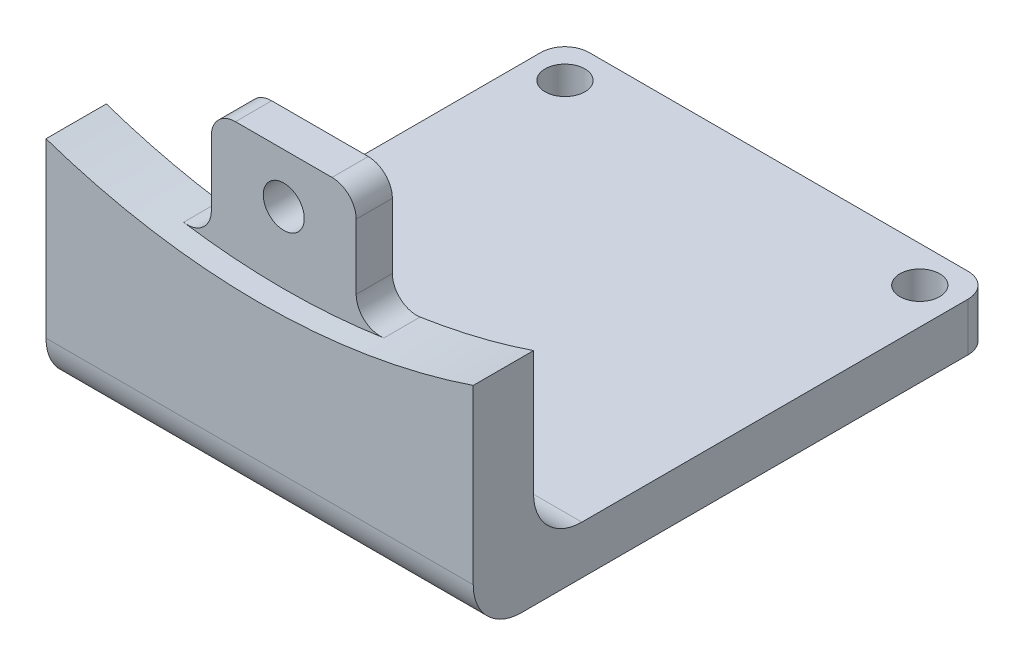
from build123d import *

# Parameters (mm, degrees)
SKETCH_1_W          = 35.4
SKETCH_1_H          = 43
SKETCH_1_R          = 1.65
EXTRUDE_1_DEPTH     = 4
SKETCH_2_W          = 35.4
SKETCH_2_H          = 5
EXTRUDE_2_DEPTH     = 20
SKETCH_3_R          = 55
CUT_EXTRUDE_1_DEPTH = 52.689555338
EXTRUDE_3_DEPTH     = 3
SKETCH_5_R          = 1.7
CUT_EXTRUDE_2_DEPTH = 53.34683038
FILLET_2_R          = 2
CUT_EXTRUDE_START   = -3
CUT_EXTRUDE_3_DEPTH = 3
FILLET_3_R          = 4
FILLET_4_R          = 4


# Read off the part's stored shape, not the designer's step: 切除-拉伸3
with BuildPart() as part:
    # 草图1 → 凸台-拉伸1 (new body)
    with BuildSketch(Plane(origin=(0, 0, 0), x_dir=(1, 0, 0), z_dir=(0, 1, 0))):
        with Locations((7.830572478, 3.085726019)):
            Rectangle(SKETCH_1_W, SKETCH_1_H)
        with Locations(Location((-6.869427522, 21.585726019, 0), (0, 0, 270))):
            Circle(SKETCH_1_R, mode=Mode.SUBTRACT)
        with Locations(Location((22.530572478, 21.585726019, 0), (0, 0, 270))):
            Circle(SKETCH_1_R, mode=Mode.SUBTRACT)
    extrude(amount=EXTRUDE_1_DEPTH)

    # 草图2 → 凸台-拉伸2 (add)
    with BuildSketch(Plane(origin=(0, 4, 0), x_dir=(1, 0, 0), z_dir=(0, 1, 0))):
        with Locations((7.830572478, -15.914273981)):
            Rectangle(SKETCH_2_W, SKETCH_2_H)
    extrude(amount=EXTRUDE_2_DEPTH)

    # 草图3 → 切除-拉伸1 (cut, through all)
    with BuildSketch(Plane(origin=(0, 0, 13.414273981), x_dir=(-1, 0, 0), z_dir=(0, 0, -1))):
        with Locations((-7.830572478, 70.384651263)):
            Circle(SKETCH_3_R)
    extrude(amount=-CUT_EXTRUDE_1_DEPTH, mode=Mode.SUBTRACT)

    # 草图4 → 凸台-拉伸3 (add)
    with BuildSketch(Plane(origin=(0, 0, 13.414273981), x_dir=(-1, 0, 0), z_dir=(0, 0, -1))):
        Polygon((-7.830572478, 25.384651263), (-13.830572478, 25.384651263), (-13.830572478, 12.582595885), (-1.830572478, 12.582595885), (-1.830572478, 25.384651263), align=None)
    extrude(amount=-EXTRUDE_3_DEPTH)

    # 草图5 → 切除-拉伸2 (cut, through all)
    with BuildSketch(Plane(origin=(0, 0, 13.414273981), x_dir=(-1, 0, 0), z_dir=(0, 0, -1))):
        with Locations((-7.830572478, 21.284651263)):
            Circle(SKETCH_5_R)
    extrude(amount=-CUT_EXTRUDE_2_DEPTH, mode=Mode.SUBTRACT)

    # 圆角2
    fillet_2_edges = [part.edges().sort_by_distance(p)[0] for p in [
        (13.830572478, 15.712903531, 14.914273981),
        (1.830572478, 15.712903531, 14.914273981),
        (1.830572478, 25.384651263, 14.914273981),
        (13.830572478, 25.384651263, 14.914273981),
        (-9.869427522, 2, -24.585726019),
        (25.530572478, 2, -24.585726019),
    ]]
    fillet(fillet_2_edges, radius=FILLET_2_R)

    # 切除-拉伸3 outline → 切除-拉伸3 (cut)
    # profile 1 of 3: a face of its own
    with BuildSketch(Plane.ZY.offset(9.869427522).offset(CUT_EXTRUDE_START)):
        with BuildLine():
            add(Edge.make_bspline(
                [(8.542988895, 3.699263411), (8.578017603, 3.693525875), (8.648085356, 3.682049107), (8.749158834, 3.64727766), (8.844028059, 3.59764261), (8.913104505, 3.542504105), (8.953125929, 3.504314465), (8.966771114, 3.490143141), (8.968705452, 3.488113466)],
                knots=[0, 0, 0, 0, 0.181146539, 0.362346535, 0.543653396, 0.725617877, 0.811880467, 0.826217423, 0.826217423, 0.826217423, 0.826217423], degree=3))
            add(Edge.make_bspline(
                [(7.796451499, 2.585796546), (7.806473258, 2.660623766), (7.82639357, 2.809358292), (7.871818557, 2.989926881), (7.915645712, 3.125628587), (7.948457101, 3.217263331), (7.984732325, 3.297067627), (8.020915746, 3.367793665), (8.061564878, 3.429260285), (8.104415721, 3.484405595), (8.150999897, 3.53355184), (8.20072521, 3.575324459), (8.249879153, 3.610852801), (8.295037608, 3.641147726), (8.336271324, 3.663779176), (8.386620864, 3.685745692), (8.455521175, 3.701982318), (8.51231786, 3.700216811), (8.542988895, 3.699263411)],
                knots=[0, 0, 0, 0, 0.154226345, 0.306556652, 0.379675384, 0.445752334, 0.50534458, 0.558760679, 0.607948867, 0.655725679, 0.701371485, 0.746071266, 0.78825069, 0.825317709, 0.857153149, 0.884242778, 0.937489417, 1, 1, 1, 1], degree=3))
            add(Edge.make_bspline(
                [(8.610855931, 0.408085061), (8.575714957, 0.406913862), (8.504992138, 0.404556772), (8.400847519, 0.426830292), (8.304198088, 0.464755289), (8.229785389, 0.507010784), (8.177926324, 0.550761223), (8.139300445, 0.588028867), (8.103317507, 0.632319006), (8.067803178, 0.682054067), (8.033986779, 0.737795062), (8.000738638, 0.799355074), (7.969947041, 0.867439943), (7.927955442, 0.967649618), (7.883311778, 1.105978134), (7.848061477, 1.253243487), (7.824628691, 1.379539283), (7.810100145, 1.481640827), (7.796562361, 1.588515188), (7.781651532, 1.737314883), (7.770871829, 1.923867335), (7.764484201, 2.146011881), (7.771015856, 2.366377706), (7.787931468, 2.512299076), (7.796451499, 2.585796546)],
                knots=[0, 0, 0, 0, 0.040560554, 0.081629972, 0.122067936, 0.160498857, 0.179908728, 0.200453509, 0.222515076, 0.245822335, 0.271131183, 0.297900222, 0.326730499, 0.357554046, 0.423594813, 0.494619703, 0.532646947, 0.572188961, 0.613933823, 0.657297468, 0.745202701, 0.830085187, 0.914417547, 1, 1, 1, 1], degree=3))
            add(Edge.make_bspline(
                [(9.273864668, 1.713220369), (9.273638936, 1.682642656), (9.27322968, 1.627204593), (9.272378609, 1.55287537), (9.271979757, 1.495934294), (9.270452324, 1.452411583), (9.26769673, 1.413905635), (9.264878999, 1.371860404), (9.260393262, 1.322380052), (9.252331338, 1.2498773), (9.244515833, 1.163933139), (9.233013311, 1.067727067), (9.216225718, 0.973292399), (9.184664405, 0.872973528), (9.14142077, 0.765094221), (9.091515475, 0.676969696), (9.040827069, 0.611178665), (8.996038577, 0.564250987), (8.942388022, 0.522949187), (8.883385789, 0.485268116), (8.819839687, 0.452744543), (8.752069638, 0.430188452), (8.682431417, 0.41366452), (8.634811881, 0.409952477), (8.610855931, 0.408085061)],
                knots=[0, 0, 0, 0, 0.056090983, 0.101694181, 0.136353878, 0.160539566, 0.181560551, 0.207162126, 0.237837007, 0.272685179, 0.340973981, 0.396120934, 0.450409014, 0.516624624, 0.588604774, 0.663379156, 0.701414258, 0.7407581, 0.781993536, 0.825256768, 0.869102472, 0.91250966, 0.955986255, 1, 1, 1, 1], degree=3))
            Line((9.273864668, 1.713220369), (9.056839311, 1.723661451))
            Line((9.056839311, 1.723661451), (9.026261855, 1.418632685))
            add(Edge.make_bspline(
                [(8.538514146, 0.666128956), (8.560721235, 0.665996724), (8.605676303, 0.665729041), (8.672671991, 0.681776501), (8.737725113, 0.708970589), (8.798354887, 0.75041177), (8.853607671, 0.804529551), (8.899786922, 0.874076192), (8.938148098, 0.956951853), (8.964753335, 1.053783005), (8.986495719, 1.160375151), (9.000914431, 1.252741791), (9.011285513, 1.322970517), (9.01841819, 1.364880529), (9.022654046, 1.395532331), (9.025252731, 1.412171385), (9.026261855, 1.418632685)],
                knots=[0, 0, 0, 0, 0.066450197, 0.134518894, 0.205066106, 0.277089639, 0.353600486, 0.435768077, 0.52624402, 0.62659438, 0.736355408, 0.852775754, 0.907126108, 0.949449962, 0.980370342, 1, 1, 1, 1], degree=3))
            add(Edge.make_bspline(
                [(8.051512228, 1.817631193), (8.055231722, 1.773108495), (8.062891766, 1.681417043), (8.076858984, 1.564778069), (8.092563188, 1.465158469), (8.10830886, 1.382604433), (8.127790455, 1.293101618), (8.150134461, 1.200347111), (8.173388876, 1.111385129), (8.197122312, 1.034039896), (8.219100978, 0.971276847), (8.247394819, 0.908279327), (8.286955318, 0.843848766), (8.336463702, 0.777368326), (8.387037493, 0.725320468), (8.435664194, 0.688088547), (8.486745658, 0.669505669), (8.520976834, 0.667272865), (8.538514146, 0.666128956)],
                knots=[0, 0, 0, 0, 0.100728522, 0.2074435, 0.264759375, 0.328077893, 0.396897856, 0.471260082, 0.543180506, 0.604168904, 0.653635522, 0.693017991, 0.759632004, 0.823641362, 0.879525224, 0.922919229, 0.960509989, 1, 1, 1, 1], degree=3))
            add(Edge.make_bspline(
                [(8.570583185, 3.441965308), (8.555145929, 3.442560925), (8.523984927, 3.443763213), (8.476539512, 3.434419529), (8.429968774, 3.41383234), (8.382605685, 3.385696551), (8.33646324, 3.346113205), (8.293638963, 3.294305952), (8.251278273, 3.232078596), (8.214030138, 3.15811186), (8.179299298, 3.07684835), (8.148828961, 2.990107864), (8.122563484, 2.899293171), (8.096036423, 2.775171157), (8.071343024, 2.623800293), (8.053036372, 2.449412115), (8.045977655, 2.284560003), (8.041386392, 2.126163203), (8.04394421, 1.970935488), (8.048997009, 1.868581636), (8.051512228, 1.817631193)],
                knots=[0, 0, 0, 0, 0.025029465, 0.050523433, 0.077664636, 0.10736617, 0.13972527, 0.175806298, 0.216226833, 0.261728794, 0.310019606, 0.359687961, 0.410926196, 0.463427513, 0.565701011, 0.659859465, 0.747978257, 0.833586678, 0.917161569, 1, 1, 1, 1], degree=3))
            add(Edge.make_bspline(
                [(8.962123777, 2.231545534), (8.961954636, 2.267344312), (8.961644527, 2.33297883), (8.960032074, 2.428194313), (8.957552163, 2.522160906), (8.954625937, 2.62334563), (8.951291957, 2.731396882), (8.941473496, 2.841735868), (8.924970279, 2.953138568), (8.901179776, 3.064528242), (8.870004369, 3.170539875), (8.832875929, 3.249253775), (8.799143039, 3.303054233), (8.772355857, 3.33722208), (8.743922441, 3.367239882), (8.702302859, 3.398216447), (8.645489436, 3.428692325), (8.595598073, 3.437532805), (8.570583185, 3.441965308)],
                knots=[0, 0, 0, 0, 0.078227482, 0.143424532, 0.208089835, 0.283630523, 0.364637885, 0.444263732, 0.525545668, 0.610571659, 0.69304657, 0.766429327, 0.799885619, 0.831617141, 0.86119718, 0.889880721, 0.94478761, 1, 1, 1, 1], degree=3))
            Line((8.962123777, 2.231545534), (9.199285507, 2.231545534))
            Line((9.199285507, 2.231545534), (9.199285507, 3.646312208))
            Line((9.199285507, 3.646312208), (8.987480692, 3.646312208))
            Line((8.987480692, 3.646312208), (8.968705452, 3.488113466))
        make_face()
    # profile 2 of 3: a face of its own
    with BuildSketch(Plane.ZY.offset(9.869427522).offset(CUT_EXTRUDE_START)):
        with BuildLine():
            add(Edge.make_bspline(
                [(6.023704855, 3.259992156), (6.016171249, 3.264095345), (5.999972487, 3.272918023), (5.984823557, 3.283446215), (5.976719984, 3.289078029)],
                knots=[0, 0, 0, 0, 0.465072976, 1, 1, 1, 1], degree=3))
            Line((6.023704855, 3.259992156), (6.023704855, 0.750403407))
            Line((6.023704855, 0.750403407), (5.931226696, 0.750403407))
            add(Edge.make_bspline(
                [(5.873054951, 0.595278753), (5.866047699, 0.603277573), (5.853290796, 0.617839654), (5.839824971, 0.64059597), (5.830789794, 0.660936636), (5.831543642, 0.685289781), (5.840286551, 0.710248707), (5.856606754, 0.737599597), (5.890495817, 0.753036081), (5.916184058, 0.7513757), (5.931226696, 0.750403407)],
                knots=[0, 0, 0, 0, 0.135453669, 0.246597291, 0.338065694, 0.414309589, 0.55095017, 0.674315892, 0.809284397, 1, 1, 1, 1], degree=3))
            Line((5.873054951, 0.595278753), (5.930480905, 0.53337805))
            add(Edge.make_bspline(
                [(6.12811568, 0.399135561), (6.12032593, 0.398875702), (6.102923271, 0.398295164), (6.076008406, 0.410010637), (6.045822655, 0.427161222), (6.01523574, 0.451966186), (5.986179573, 0.477413472), (5.962162234, 0.500652893), (5.943102006, 0.517482102), (5.934108639, 0.528809013), (5.930480905, 0.53337805)],
                knots=[0, 0, 0, 0, 0.09428508, 0.210637185, 0.350900231, 0.519934663, 0.690086105, 0.823425343, 0.928773499, 1, 1, 1, 1], degree=3))
            add(Edge.make_bspline(
                [(6.280257167, 0.462527848), (6.268176195, 0.459439858), (6.239453272, 0.452098057), (6.199146029, 0.430573079), (6.162053601, 0.409007027), (6.137428659, 0.401844412), (6.12811568, 0.399135561)],
                knots=[0, 0, 0, 0, 0.225502421, 0.536139678, 0.824571291, 1, 1, 1, 1], degree=3))
            Line((6.280257167, 0.462527848), (6.497282524, 0.487138971))
            add(Edge.make_bspline(
                [(7.460845277, 1.892210354), (7.459551707, 1.870087964), (7.456819655, 1.823364949), (7.453561322, 1.749228901), (7.447890908, 1.667478804), (7.440621899, 1.54918519), (7.426115579, 1.399067818), (7.400103124, 1.251390595), (7.372297141, 1.137476729), (7.346684468, 1.055418678), (7.313729196, 0.976965316), (7.278323507, 0.901358719), (7.237042859, 0.831809012), (7.194004078, 0.767838944), (7.14779639, 0.711201417), (7.099129861, 0.661156186), (7.046770861, 0.618917895), (6.990148705, 0.585164934), (6.929841562, 0.558565081), (6.863672189, 0.540006261), (6.789117905, 0.526296274), (6.703496521, 0.513123124), (6.604790278, 0.499661795), (6.53458806, 0.491484431), (6.497282524, 0.487138971)],
                knots=[0, 0, 0, 0, 0.034032554, 0.071877565, 0.113958999, 0.159875043, 0.25389838, 0.345415653, 0.389862195, 0.433933293, 0.477252152, 0.520454768, 0.562034426, 0.601321324, 0.638767527, 0.674133794, 0.708358539, 0.741751196, 0.775089245, 0.809282033, 0.847019048, 0.891459031, 0.94232121, 1, 1, 1, 1], degree=3))
            add(Edge.make_bspline(
                [(6.677764092, 3.650041166), (6.701382717, 3.649727059), (6.747173576, 3.649118081), (6.813532707, 3.645241834), (6.875198157, 3.635773756), (6.932850263, 3.6241235), (6.987057259, 3.608755731), (7.037407291, 3.587791411), (7.083925073, 3.561309398), (7.141340216, 3.520526883), (7.205877049, 3.460889674), (7.2577972, 3.38962737), (7.293481306, 3.327133904), (7.318222022, 3.274877525), (7.33938861, 3.21695049), (7.359610174, 3.154587185), (7.377523554, 3.086878538), (7.393182683, 3.014243245), (7.405409828, 2.936214143), (7.420429768, 2.826518842), (7.43301958, 2.686722386), (7.440208377, 2.518713008), (7.445945492, 2.349621874), (7.451003852, 2.208399685), (7.456586019, 2.097827096), (7.45857163, 2.022231766), (7.460198456, 1.954614295), (7.460639131, 1.912098878), (7.460845277, 1.892210354)],
                knots=[0, 0, 0, 0, 0.032322869, 0.062666305, 0.090856964, 0.11760919, 0.143121592, 0.167822844, 0.192041566, 0.216202886, 0.264098603, 0.311518435, 0.336200941, 0.362525872, 0.390514681, 0.42052837, 0.452213089, 0.486306076, 0.52215279, 0.560254347, 0.637801604, 0.714090463, 0.790336082, 0.869313804, 0.90745027, 0.941822123, 0.972784646, 1, 1, 1, 1], degree=3))
            add(Edge.make_bspline(
                [(6.448060278, 3.618717918), (6.464672977, 3.622883898), (6.499405504, 3.6315938), (6.554412874, 3.641315832), (6.614529337, 3.646868795), (6.65612765, 3.648955705), (6.677764092, 3.650041166)],
                knots=[0, 0, 0, 0, 0.221093908, 0.462245781, 0.720299036, 1, 1, 1, 1], degree=3))
            Line((6.448060278, 3.618717918), (6.264595544, 3.566512506))
            Line((6.264595544, 3.566512506), (6.163167885, 3.556071423))
            add(Edge.make_bspline(
                [(6.0818766, 3.541901383), (6.083619257, 3.54213563), (6.090388505, 3.543045549), (6.105413487, 3.546565296), (6.130846559, 3.550631221), (6.151238959, 3.554063592), (6.163167885, 3.556071423)],
                knots=[0, 0, 0, 0, 0.063902159, 0.248224169, 0.560234273, 1, 1, 1, 1], degree=3))
            Line((6.0818766, 3.541901383), (5.991635816, 3.541901383))
            Line((5.991635816, 3.541901383), (5.884987617, 3.556817215))
            add(Edge.make_bspline(
                [(5.889462367, 3.362165606), (5.877588087, 3.371180864), (5.855145297, 3.388220006), (5.833472837, 3.423190794), (5.82477042, 3.459210101), (5.82919364, 3.49573172), (5.851168219, 3.529356142), (5.872938115, 3.547033119), (5.884987617, 3.556817215)],
                knots=[0, 0, 0, 0, 0.186824748, 0.353105091, 0.507602397, 0.64692401, 0.804574648, 1, 1, 1, 1], degree=3))
            Line((5.889462367, 3.362165606), (5.976719984, 3.289078029))
        make_face()
        with BuildLine():
            add(Edge.make_bspline(
                [(6.724748964, 3.38230198), (6.710077665, 3.382802057), (6.67871847, 3.383870949), (6.628448419, 3.380052257), (6.571607987, 3.374529076), (6.511520553, 3.364099067), (6.454208126, 3.352543293), (6.405263227, 3.342541451), (6.367773778, 3.332566772), (6.347083468, 3.324515032), (6.338428912, 3.321147068)],
                knots=[0, 0, 0, 0, 0.111968851, 0.239328025, 0.384335123, 0.547796086, 0.704463791, 0.830630012, 0.929154181, 1, 1, 1, 1], degree=3))
            add(Edge.make_bspline(
                [(7.179681842, 2.326261068), (7.176097852, 2.384426934), (7.168471094, 2.508204345), (7.160576986, 2.665424797), (7.151428599, 2.794262003), (7.142015751, 2.883884329), (7.129763686, 2.963166688), (7.113584623, 3.03272189), (7.096310076, 3.094669343), (7.074192305, 3.149218303), (7.050616974, 3.198194183), (7.023708273, 3.241246682), (6.993191288, 3.278292052), (6.958251078, 3.308482353), (6.919678665, 3.333075536), (6.864906015, 3.354750786), (6.799993796, 3.373936216), (6.748231182, 3.379691213), (6.724748964, 3.38230198)],
                knots=[0, 0, 0, 0, 0.136640976, 0.290773049, 0.369097972, 0.439454447, 0.502030717, 0.557036223, 0.606838664, 0.652624568, 0.694855191, 0.734151897, 0.771393271, 0.806925877, 0.842020712, 0.878070684, 0.94468651, 1, 1, 1, 1], degree=3))
            add(Edge.make_bspline(
                [(6.574844851, 0.784709821), (6.602468677, 0.787409801), (6.654660863, 0.792511117), (6.728546409, 0.804096272), (6.793107023, 0.820139401), (6.851099834, 0.837071219), (6.902871198, 0.863368719), (6.948666664, 0.901214612), (6.988416857, 0.951361601), (7.034681091, 1.030559532), (7.08054244, 1.136557599), (7.119709296, 1.26887249), (7.145107655, 1.407048955), (7.164271079, 1.557201523), (7.17778308, 1.722927078), (7.182009927, 1.871794294), (7.182778036, 1.999851405), (7.182734338, 2.103767108), (7.182231298, 2.213160341), (7.180544781, 2.287978762), (7.179681842, 2.326261068)],
                knots=[0, 0, 0, 0, 0.044586728, 0.084241725, 0.119983467, 0.151431271, 0.181080545, 0.212579023, 0.246072531, 0.283330476, 0.359683619, 0.430945885, 0.504568203, 0.585111347, 0.674059169, 0.771554225, 0.824270638, 0.879781026, 0.938487614, 1, 1, 1, 1], degree=3))
            Line((6.574844851, 0.784709821), (6.357073703, 0.760098698))
            add(Edge.make_bspline(
                [(6.305614082, 0.755623948), (6.311087205, 0.755820013), (6.328306759, 0.75643687), (6.345407988, 0.758613735), (6.357073703, 0.760098698)],
                knots=[0, 0, 0, 0, 0.317843486, 1, 1, 1, 1], degree=3))
            Line((6.305614082, 0.755623948), (6.305614082, 3.307722819))
            Line((6.305614082, 3.307722819), (6.338428912, 3.321147068))
        make_face(mode=Mode.SUBTRACT)
    # profile 3 of 3: a face of its own
    with BuildSketch(Plane.ZY.offset(9.869427522).offset(CUT_EXTRUDE_START)):
        with BuildLine():
            add(Edge.make_bspline(
                [(4.76182546, 2.315819985), (4.776004563, 2.317997912), (4.807677612, 2.322862929), (4.856782867, 2.331823619), (4.905660179, 2.343294521), (4.949425123, 2.354215127), (4.986124041, 2.366687088), (5.018751054, 2.379245349), (5.047949556, 2.393608938), (5.064770697, 2.406065795), (5.07282056, 2.412027102)],
                knots=[0, 0, 0, 0, 0.130990317, 0.292604035, 0.455598752, 0.589391318, 0.704242921, 0.809202221, 0.908692525, 1, 1, 1, 1], degree=3))
            Line((4.76182546, 2.315819985), (4.448592987, 2.262868781))
            Line((4.448592987, 2.262868781), (4.448592987, 3.283408676))
            Line((4.448592987, 3.283408676), (4.990783483, 3.357690857))
            add(Edge.make_bspline(
                [(5.218995714, 3.387522521), (5.20159204, 3.385299418), (5.169017316, 3.381138404), (5.123531501, 3.375115067), (5.084967336, 3.370125574), (5.053239863, 3.365197731), (5.028067927, 3.362454895), (5.009664577, 3.360275546), (4.997986753, 3.358728812), (4.992523364, 3.357941565), (4.990783483, 3.357690857)],
                knots=[0, 0, 0, 0, 0.228689354, 0.428041364, 0.59805775, 0.735532814, 0.846463445, 0.928052575, 0.977087489, 1, 1, 1, 1], degree=3))
            Line((5.218995714, 3.387522521), (5.292083291, 3.397217812))
            add(Edge.make_bspline(
                [(5.385307242, 3.553088257), (5.391761487, 3.544542321), (5.403260009, 3.529317361), (5.41543934, 3.507256123), (5.424932713, 3.49106747), (5.428971331, 3.472599444), (5.416059536, 3.448977607), (5.389373111, 3.42398249), (5.346317731, 3.399943545), (5.311104226, 3.398173772), (5.292083291, 3.397217812)],
                knots=[0, 0, 0, 0, 0.125664459, 0.223876746, 0.295739572, 0.346174886, 0.437869688, 0.590747101, 0.778937871, 1, 1, 1, 1], degree=3))
            Line((5.385307242, 3.553088257), (5.195876174, 3.720145576))
            Line((5.195876174, 3.720145576), (5.095940099, 3.680618621))
            add(Edge.make_bspline(
                [(4.784945, 3.590377837), (4.803846571, 3.593305227), (4.836722803, 3.59839695), (4.882605277, 3.606227197), (4.924220212, 3.615810138), (4.966345293, 3.628335222), (5.007998127, 3.641463526), (5.044504058, 3.654990749), (5.073726415, 3.666680485), (5.089320151, 3.676464887), (5.095940099, 3.680618621)],
                knots=[0, 0, 0, 0, 0.176185082, 0.306445521, 0.42864751, 0.569245449, 0.711179619, 0.830713641, 0.928133516, 1, 1, 1, 1], degree=3))
            Line((4.784945, 3.590377837), (4.579852309, 3.553088257))
            add(Edge.make_bspline(
                [(4.407574448, 3.541901383), (4.425724301, 3.541790688), (4.459545618, 3.541584415), (4.506570013, 3.542901834), (4.546071176, 3.545976967), (4.569442489, 3.550896879), (4.579852309, 3.553088257)],
                knots=[0, 0, 0, 0, 0.314625091, 0.586287644, 0.815728322, 1, 1, 1, 1], degree=3))
            Line((4.407574448, 3.541901383), (4.386692283, 3.541155591))
            add(Edge.make_bspline(
                [(4.239025546, 3.551596674), (4.257927519, 3.548934204), (4.290232553, 3.544383824), (4.332285225, 3.537622236), (4.362989839, 3.537158201), (4.379749998, 3.539984783), (4.386692283, 3.541155591)],
                knots=[0, 0, 0, 0, 0.384867899, 0.657771003, 0.858244108, 1, 1, 1, 1], degree=3))
            Line((4.239025546, 3.551596674), (4.14356422, 3.566512506))
            add(Edge.make_bspline(
                [(4.16220901, 3.283111696), (4.155014971, 3.291577163), (4.138688703, 3.310788831), (4.112612103, 3.340716459), (4.086497329, 3.372163359), (4.064011856, 3.402127799), (4.047577564, 3.431524018), (4.039862315, 3.46347166), (4.040874136, 3.49740556), (4.04066126, 3.527397182), (4.052478487, 3.551937662), (4.075161856, 3.562611986), (4.105935193, 3.568057253), (4.129839392, 3.567075938), (4.14356422, 3.566512506)],
                knots=[0, 0, 0, 0, 0.082853737, 0.1880296, 0.296043335, 0.387645757, 0.467262338, 0.545507056, 0.628960216, 0.720280755, 0.766743288, 0.822395889, 0.898026869, 1, 1, 1, 1], degree=3))
            Line((4.16220901, 3.283111696), (4.167429552, 1.038278967))
            add(Edge.make_bspline(
                [(4.16220901, 0.915969143), (4.163032327, 0.929638586), (4.164543864, 0.954734469), (4.165530916, 0.988824802), (4.167732063, 1.015882642), (4.167520249, 1.031564211), (4.167429552, 1.038278967)],
                knots=[0, 0, 0, 0, 0.33549466, 0.615938402, 0.835547081, 1, 1, 1, 1], degree=3))
            Line((4.16220901, 0.915969143), (4.16220901, 0.821999401))
            add(Edge.make_bspline(
                [(4.117461514, 0.572905005), (4.118249584, 0.579664016), (4.120307065, 0.597310345), (4.131181236, 0.626222303), (4.142056886, 0.66194862), (4.150683824, 0.704647422), (4.15738904, 0.758216497), (4.160441566, 0.798610721), (4.16220901, 0.821999401)],
                knots=[0, 0, 0, 0, 0.080154866, 0.209267186, 0.362564664, 0.521523827, 0.722957268, 1, 1, 1, 1], degree=3))
            add(Edge.make_bspline(
                [(4.372522243, 0.457307307), (4.351809583, 0.449865355), (4.310864046, 0.435153834), (4.257874855, 0.423959617), (4.216956341, 0.423538994), (4.188824712, 0.428304818), (4.164711289, 0.440805496), (4.143752642, 0.458261715), (4.128386751, 0.48142762), (4.118526209, 0.508750687), (4.113751217, 0.539762955), (4.116181611, 0.561472329), (4.117461514, 0.572905005)],
                knots=[0, 0, 0, 0, 0.182087604, 0.359957387, 0.444272652, 0.519692124, 0.593266627, 0.666206108, 0.743207106, 0.819988101, 0.905201423, 1, 1, 1, 1], degree=3))
            Line((4.372522243, 0.457307307), (4.575377559, 0.492359512))
            add(Edge.make_bspline(
                [(5.312965456, 0.596024545), (5.293572675, 0.594057411), (5.251537565, 0.589793519), (5.183385041, 0.5823803), (5.105565827, 0.572688233), (5.01807204, 0.560629922), (4.921111558, 0.546485256), (4.814542824, 0.529801894), (4.698116144, 0.512187001), (4.617379081, 0.49914454), (4.575377559, 0.492359512)],
                knots=[0, 0, 0, 0, 0.078496334, 0.17014589, 0.276065189, 0.394285394, 0.525812547, 0.670655771, 0.828666561, 1, 1, 1, 1], degree=3))
            Line((5.312965456, 0.596024545), (5.383069867, 0.600499295))
            add(Edge.make_bspline(
                [(5.481514359, 0.757861323), (5.488850872, 0.749152383), (5.502016335, 0.733524081), (5.514800969, 0.70945347), (5.522010178, 0.68823248), (5.516886744, 0.664989282), (5.503942094, 0.642665221), (5.488858861, 0.621328967), (5.468946819, 0.61021665), (5.446795027, 0.604623403), (5.417472865, 0.601364001), (5.395260888, 0.600805711), (5.383069867, 0.600499295)],
                knots=[0, 0, 0, 0, 0.128778164, 0.231094015, 0.309853046, 0.375771773, 0.493216524, 0.603483504, 0.665475281, 0.747701152, 0.861526043, 1, 1, 1, 1], degree=3))
            Line((5.481514359, 0.757861323), (5.304761749, 0.928647601))
            Line((5.304761749, 0.928647601), (5.204079882, 0.897324353))
            add(Edge.make_bspline(
                [(5.081770059, 0.853322649), (5.091750658, 0.855143651), (5.112183546, 0.858871716), (5.142769085, 0.867811931), (5.173706447, 0.880700648), (5.193735156, 0.891662574), (5.204079882, 0.897324353)],
                knots=[0, 0, 0, 0, 0.232685934, 0.476368751, 0.729547112, 1, 1, 1, 1], degree=3))
            Line((5.081770059, 0.853322649), (4.448592987, 0.750403407))
            Line((4.448592987, 0.750403407), (4.448592987, 2.006316469))
            Line((4.448592987, 2.006316469), (5.274184293, 2.12265996))
            add(Edge.make_bspline(
                [(5.356967161, 2.285988321), (5.36439016, 2.277199279), (5.377737038, 2.261396195), (5.392716224, 2.238332586), (5.402033533, 2.219708091), (5.404916888, 2.19866755), (5.390502447, 2.174107831), (5.364105983, 2.148287229), (5.323301423, 2.126320066), (5.29113334, 2.123922967), (5.274184293, 2.12265996)],
                knots=[0, 0, 0, 0, 0.133343141, 0.239756827, 0.318540792, 0.373648818, 0.478208945, 0.629142271, 0.804598699, 1, 1, 1, 1], degree=3))
            Line((5.356967161, 2.285988321), (5.173502426, 2.445587724))
            Line((5.173502426, 2.445587724), (5.07282056, 2.412027102))
        make_face()
    extrude(amount=CUT_EXTRUDE_3_DEPTH, mode=Mode.SUBTRACT)

    # 圆角3
    fillet_3_edges = [part.edges().sort_by_distance(p)[0] for p in [
        (7.830572478, 4, 13.414273981),
    ]]
    fillet(fillet_3_edges, radius=FILLET_3_R)

    # 圆角4
    fillet_4_edges = [part.edges().sort_by_distance(p)[0] for p in [
        (7.830572478, 0, 18.414273981),
    ]]
    fillet(fillet_4_edges, radius=FILLET_4_R)


solid = part.part
